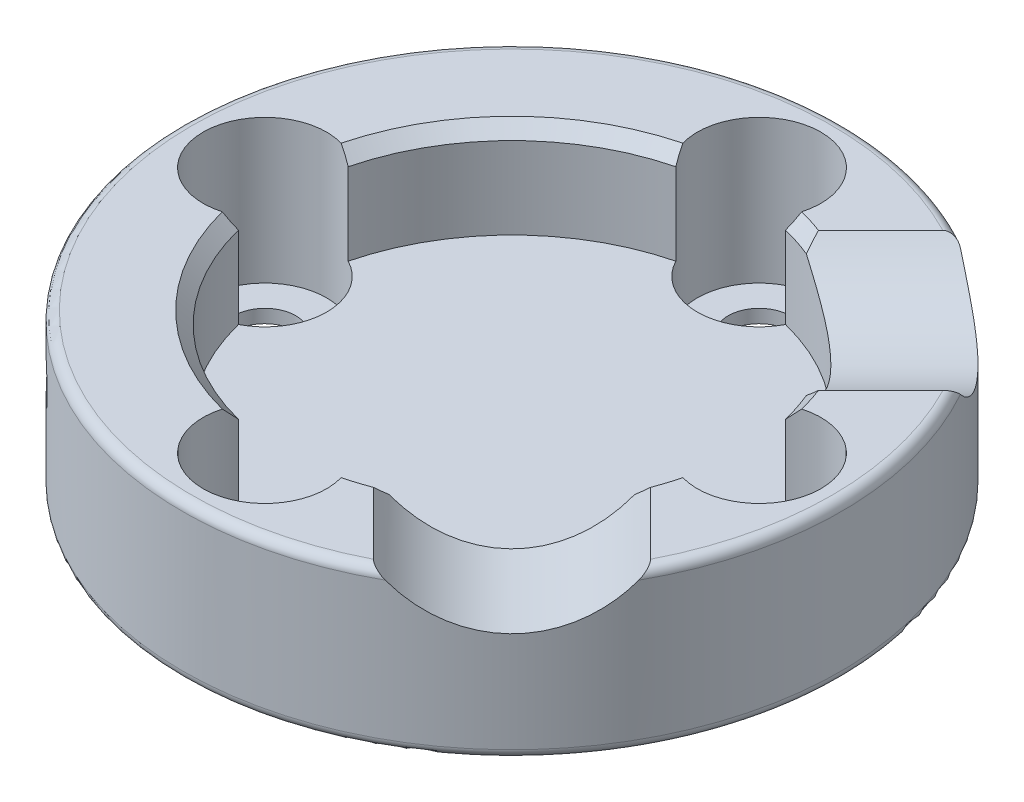
from build123d import *

# Parameters (mm, degrees)
SKETCH1_R               = 26.67
BOSS_EXTRUDE1_DEPTH     = 12.7
SKETCH2_R               = 2.5
CUT_EXTRUDE1_DEPTH      = 15.24
SKETCH3_R               = 18.25
CUT_EXTRUDE2_DEPTH      = 7.62
CUT_EXTRUDE3_DEPTH      = 39.479113815
CUT_EXTRUDE3_DEPTH_BACK = 4
SKETCH4_R               = 5
SKETCH5_R               = 1.905
CUT_EXTRUDE4_DEPTH      = 40.797836625
FILLET1_R               = 0.762
CHAMFER1_SIZE           = 1
SKETCH6_R               = 10.16
CUT_EXTRUDE5_DEPTH      = 35.814
CIRPATTERN1_COUNT       = 2
CIRPATTERN1_ANGLE       = 90


with BuildPart() as part:
    # Sketch1 → Boss-Extrude1 (new body)
    with BuildSketch(Plane(origin=(0, 0, 0), x_dir=(1, 0, 0), z_dir=(0, 1, 0))):
        Circle(SKETCH1_R)
    extrude(amount=BOSS_EXTRUDE1_DEPTH)

    # Sketch2 → Cut-Extrude1 (cut)
    with BuildSketch(Plane(origin=(0, 12.7, 0), x_dir=(1, 0, 0), z_dir=(0, 1, 0))):
        with Locations((0, 20)):
            Circle(SKETCH2_R)
        with Locations((20, 0)):
            Circle(SKETCH2_R)
        with Locations((0, -20)):
            Circle(SKETCH2_R)
        with Locations((-20, 0)):
            Circle(SKETCH2_R)
    extrude(amount=-CUT_EXTRUDE1_DEPTH, mode=Mode.SUBTRACT)

    # Sketch3 → Cut-Extrude2 (cut)
    with BuildSketch(Plane(origin=(0, 12.7, 0), x_dir=(1, 0, 0), z_dir=(0, 1, 0))):
        Circle(SKETCH3_R)
    extrude(amount=-CUT_EXTRUDE2_DEPTH, mode=Mode.SUBTRACT)

    # Sketch4 → Cut-Extrude3 (cut, two sides: drawn at the far end of the back side and taken through both)
    with BuildSketch(Plane(origin=(0, 5.08, 0), x_dir=(1, 0, 0), z_dir=(0, 1, 0)).offset(-CUT_EXTRUDE3_DEPTH_BACK)):
        with Locations((0, 20)):
            Circle(SKETCH4_R)
        with Locations((20, 0)):
            Circle(SKETCH4_R)
        with Locations((0, -20)):
            Circle(SKETCH4_R)
        with Locations((-20, 0)):
            Circle(SKETCH4_R)
    extrude(amount=CUT_EXTRUDE3_DEPTH + CUT_EXTRUDE3_DEPTH_BACK, mode=Mode.SUBTRACT)

    # Sketch5 → Cut-Extrude4 (cut, through all)
    with BuildSketch(Plane(origin=(0, 0, 0), x_dir=(0, 1, 0), z_dir=(0.7071067811865464, 0, -0.7071067811865488))):
        with Locations((8.128, 0)):
            Circle(SKETCH5_R)
    extrude(amount=-CUT_EXTRUDE4_DEPTH, mode=Mode.SUBTRACT)

    # Fillet1
    fillet1_edges = [part.edges().sort_by_distance(p)[0] for p in [
        (-26.67, 0, 0),
        (-26.67, 12.7, 0),
    ]]
    fillet(fillet1_edges, radius=FILLET1_R)

    # Chamfer1
    chamfer1_edges = [part.edges().sort_by_distance(p)[0] for p in [
        (-12.904698757, 12.7, -12.904698757),
        (-12.904698757, 12.7, 12.904698757),
        (12.904698757, 12.7, 12.904698757),
        (12.904698757, 12.7, -12.904698757),
    ]]
    chamfer(chamfer1_edges, length=CHAMFER1_SIZE)

    # Sketch6 → Cut-Extrude5 (cut)
    with BuildSketch(Plane(origin=(0, 0, 0), x_dir=(0, 1, 0), z_dir=(0.7071067811865464, 0, -0.7071067811865488))):
        with Locations((19.05, 0)):
            Circle(SKETCH6_R)
    cut_extrude5 = extrude(amount=CUT_EXTRUDE5_DEPTH, mode=Mode.SUBTRACT)

    # CirPattern1: Cut-Extrude5 ×2 about axis
    cirpattern1_axis = Axis((0, 5.08, 0), (0, -1, 0))
    for i in range(1, CIRPATTERN1_COUNT):
        add(cut_extrude5.rotate(cirpattern1_axis, i * CIRPATTERN1_ANGLE / (CIRPATTERN1_COUNT - 1)), mode=Mode.SUBTRACT)


solid = part.part
